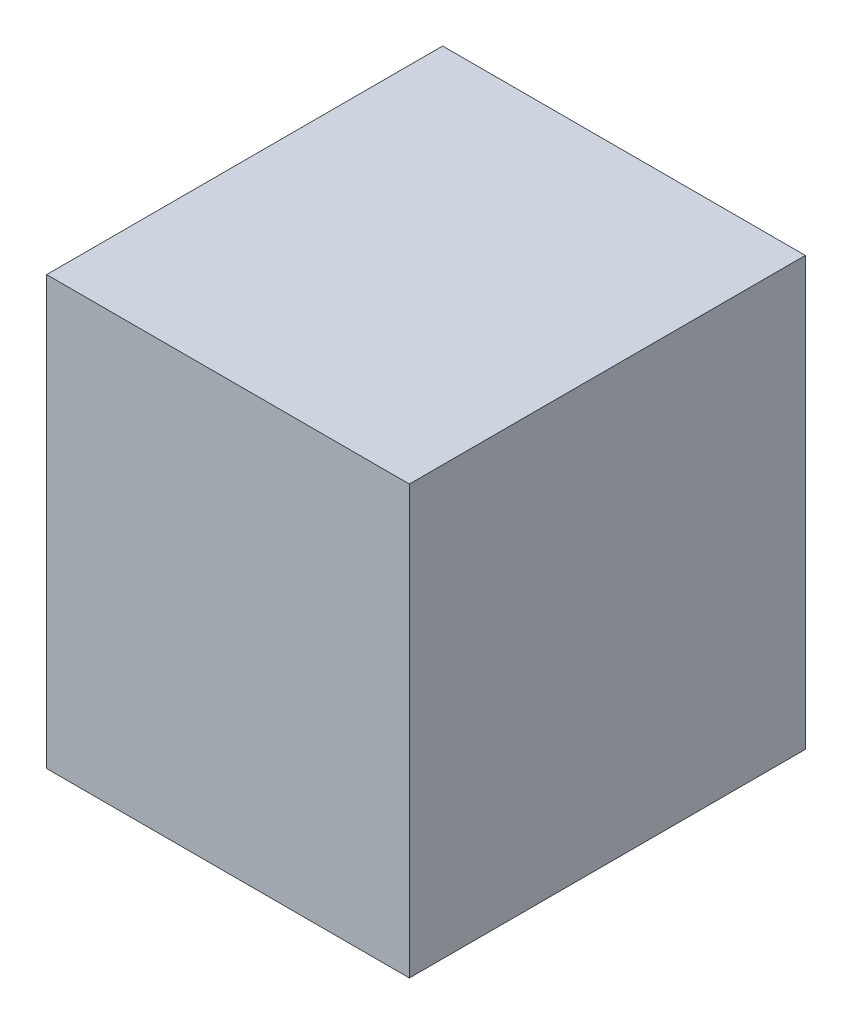
from build123d import *

# Parameters (mm, degrees)
SKETCH1_W           = 84.793949934
SKETCH1_H           = 92.563029117
BOSS_EXTRUDE1_DEPTH = 100


with BuildPart() as part:
    # Sketch1 → Boss-Extrude1 (new body)
    with BuildSketch(Plane(origin=(0, 0, 0), x_dir=(1, 0, 0), z_dir=(0, 1, 0))):
        with Locations((5.88230281, 4.8834212)):
            Rectangle(SKETCH1_W, SKETCH1_H)
    extrude(amount=BOSS_EXTRUDE1_DEPTH)


solid = part.part
